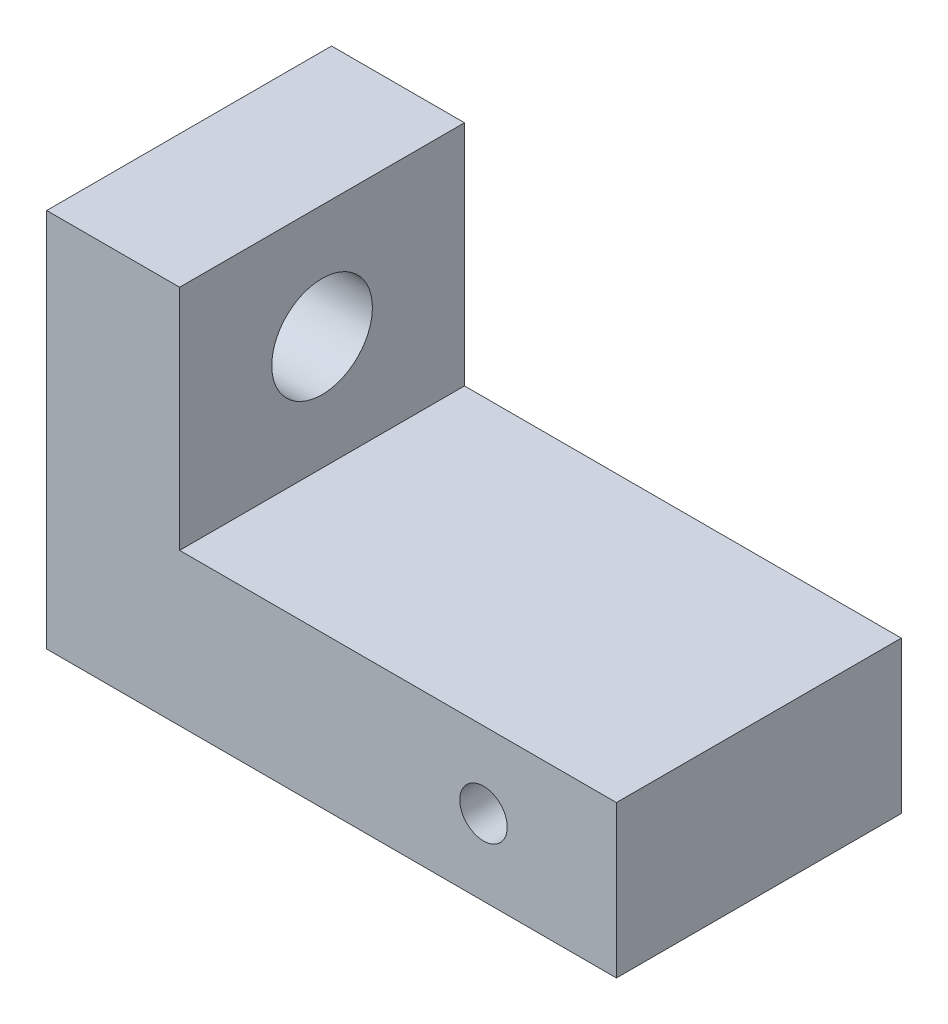
from build123d import *

# Parameters (mm, degrees)
BOSS_EXTRUDE1_DEPTH = 15
SKETCH3_R           = 2.65
CUT_EXTRUDE1_DEPTH  = 15
M3_TAPPED_HOLE1_D   = 2.5


with BuildPart() as part:
    # Sketch1 → Boss-Extrude1 (new body)
    with BuildSketch(Plane.XY):
        Polygon((0, 0), (30, 0), (30, 8), (7, 8), (7, 20), (0, 20), align=None)
    extrude(amount=BOSS_EXTRUDE1_DEPTH)

    # Sketch3 → Cut-Extrude1 (cut)
    with BuildSketch(Plane(origin=(7, 0, 0), x_dir=(0, 0, -1), z_dir=(1, 0, 0))):
        with Locations((-7.5, 14)):
            Circle(SKETCH3_R)
    extrude(amount=-CUT_EXTRUDE1_DEPTH, mode=Mode.SUBTRACT)

    # M3 Tapped Hole1 (through all)
    with Locations(Plane(origin=(23, 4, 15), x_dir=(1, 0, 0), z_dir=(0, 0, 1))):
        with Locations((0, 0)):
            Hole(M3_TAPPED_HOLE1_D / 2)


solid = part.part
